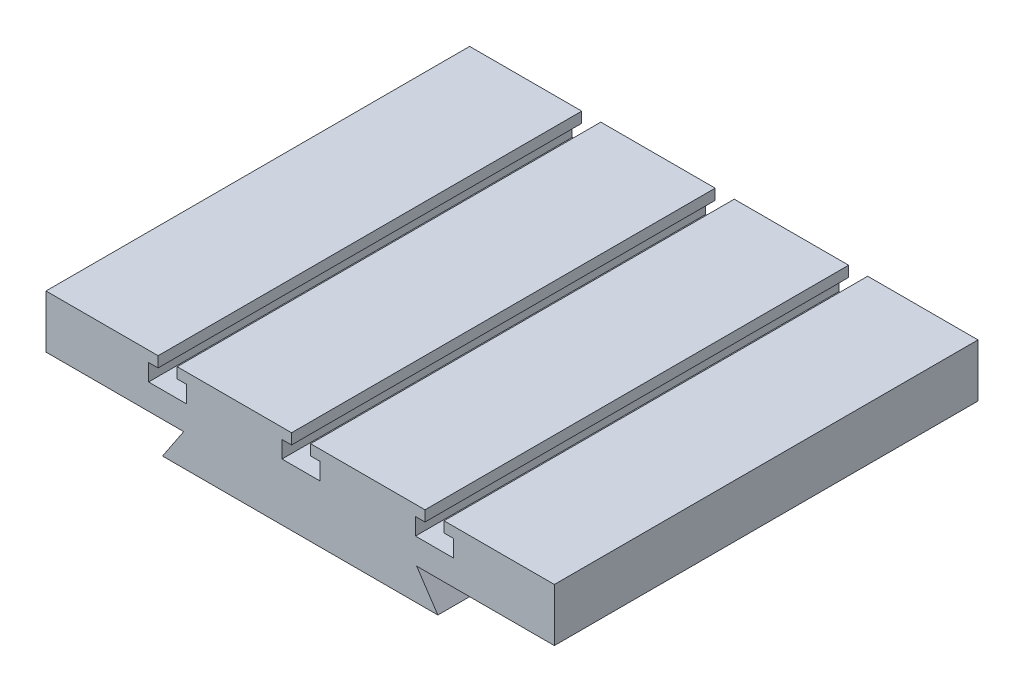
from build123d import *

# Parameters (mm, degrees)
EXTRUDE_1_DEPTH     = 200
CUT_EXTRUDE_1_DEPTH = 237.643191324


with BuildPart() as part:
    # Эскиз1 → Бобышка-Вытянуть1 (new body)
    with BuildSketch(Plane.XY):
        Polygon((0, 0), (65, 0), (55, 15), (120, 15), (120, 40), (0, 40), (-120, 40), (-120, 15), (-55, 15), (-65, 0), align=None)
    extrude(amount=EXTRUDE_1_DEPTH)

    # Эскиз2 → Вырез-Вытянуть1 (cut, through all)
    with BuildSketch(Plane.XY.offset(200)):
        Polygon((-8.573821021, 27), (9.426178979, 27), (9.426178979, 35), (4.926178979, 35), (4.926178979, 40), (-4.073821021, 40), (-4.073821021, 35), (-8.573821021, 35), align=None)
        Polygon((54.426178979, 27), (72.426178979, 27), (72.426178979, 35), (67.926178979, 35), (67.926178979, 40), (58.926178979, 40), (58.926178979, 35), (54.426178979, 35), align=None)
        Polygon((-71.573821021, 27), (-53.573821021, 27), (-53.573821021, 35), (-58.073821021, 35), (-58.073821021, 40), (-67.073821021, 40), (-67.073821021, 35), (-71.573821021, 35), align=None)
    extrude(amount=-CUT_EXTRUDE_1_DEPTH, mode=Mode.SUBTRACT)


solid = part.part
